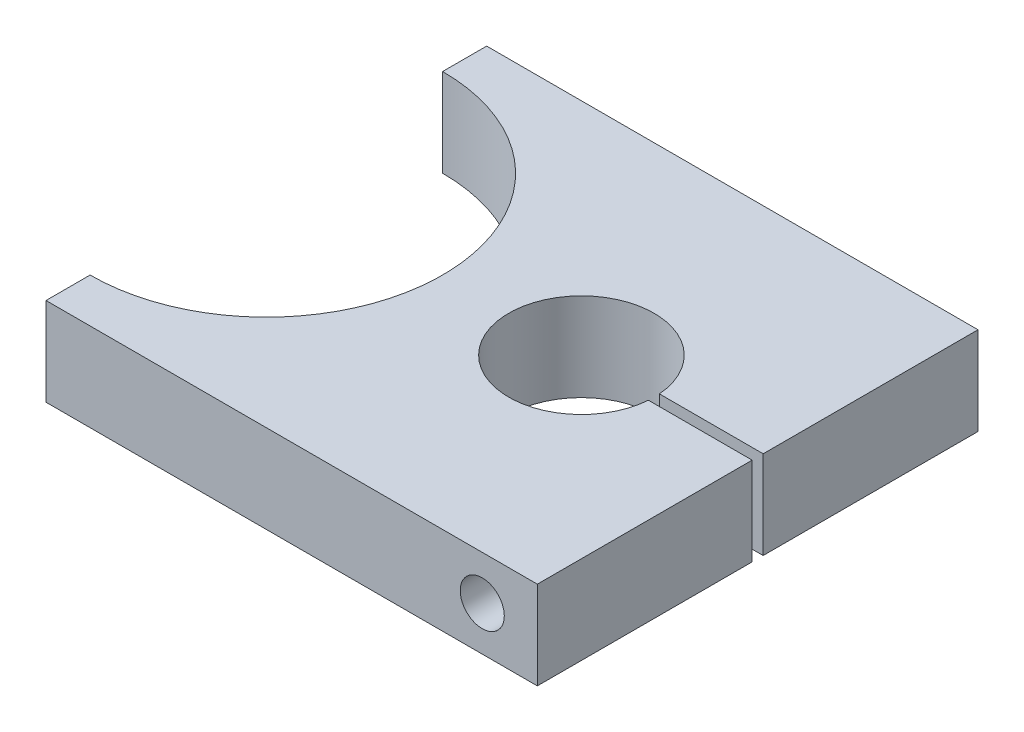
from build123d import *

# Parameters (mm, degrees)
SKETCH1_R           = 20.955
BOSS_EXTRUDE1_DEPTH = 25.4
SKETCH2_R           = 6.35
CUT_EXTRUDE1_DEPTH  = 192.901370566
SKETCH3_W           = 30.48
SKETCH3_H           = 3.175
CUT_EXTRUDE2_DEPTH  = 192.901370566


with BuildPart() as part:
    # Sketch1 → Boss-Extrude1 (new body)
    with BuildSketch(Plane(origin=(0, 0, 0), x_dir=(1, 0, 0), z_dir=(0, 1, 0))):
        with BuildLine():
            Line((0, 0), (141.605, 0))
            Line((141.605, 0), (141.605, 127))
            Line((141.605, 127), (0, 127))
            Line((0, 127), (0, 114.3))
            ThreePointArc((0, 114.3), (50.8, 63.5), (0, 12.7))
            Line((0, 12.7), (0, 0))
        make_face()
        with Locations((90.805, 63.5)):
            Circle(SKETCH1_R, mode=Mode.SUBTRACT)
    extrude(amount=BOSS_EXTRUDE1_DEPTH)

    # Sketch2 → Cut-Extrude1 (cut, through all)
    with BuildSketch(Plane.XY):
        with Locations((125.73, 12.7)):
            Circle(SKETCH2_R)
    extrude(amount=-CUT_EXTRUDE1_DEPTH, mode=Mode.SUBTRACT)

    # Sketch3 → Cut-Extrude2 (cut, through all)
    with BuildSketch(Plane(origin=(0, 25.4, 0), x_dir=(1, 0, 0), z_dir=(0, 1, 0))):
        with Locations((126.365, 63.5)):
            Rectangle(SKETCH3_W, SKETCH3_H)
    extrude(amount=-CUT_EXTRUDE2_DEPTH, mode=Mode.SUBTRACT)


solid = part.part
